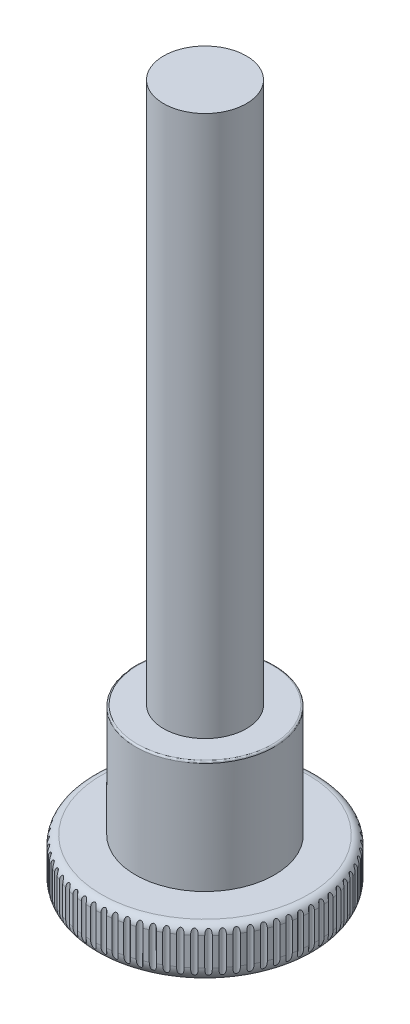
from build123d import *

# Parameters (mm, degrees)
REDONDEO1_R           = 1
REDONDEO3_R           = 0.5
CROQUIS3_R            = 0.178826811
CORTAR_EXTRUIR2_DEPTH = 30.2
MATRIZC1_COUNT        = 70
CORTAR_EXTRUIR3_DEPTH = 4
REDONDEO4_R           = 0.1


with BuildPart() as part:
    # Croquis1 → Revolución1 (revolve)
    with BuildSketch(Plane.XY):
        Polygon((0, 0), (6.75, 0), (6.75, 3.2), (4.2, 3.2), (4.2, 10), (2.5, 10), (2.5, 42.7), (0, 42.7), align=None)
    revolve(axis=Axis((0, 0, 0), (0, 1, 0)))

    # Redondeo1
    redondeo1_edges = [part.edges().sort_by_distance(p)[0] for p in [
        (-6.75, 0, 0),
    ]]
    fillet(redondeo1_edges, radius=REDONDEO1_R)

    # Redondeo3
    redondeo3_edges = [part.edges().sort_by_distance(p)[0] for p in [
        (-6.75, 3.2, 0),
    ]]
    fillet(redondeo3_edges, radius=REDONDEO3_R)

    # Croquis3 → Cortar-Extruir2 (cut)
    with BuildSketch(Plane(origin=(0, 3.2, 0), x_dir=(1, 0, 0), z_dir=(0, 1, 0))):
        with Locations((0, 6.823141063)):
            Circle(CROQUIS3_R)
    cortar_extruir2 = extrude(amount=-CORTAR_EXTRUIR2_DEPTH, mode=Mode.SUBTRACT)

    # MatrizC1: Cortar-Extruir2 ×70 about axis
    matrizc1_axis = Axis((0, 2.7, 0), (0, -1, 0))
    for i in range(1, MATRIZC1_COUNT):
        add(cortar_extruir2.rotate(matrizc1_axis, i * 360 / MATRIZC1_COUNT), mode=Mode.SUBTRACT)

    # Croquis4 → Cortar-Extruir3 (cut)
    with BuildSketch(Plane.XZ):
        Polygon((-2.598076211, 0), (-1.299038106, -2.25), (1.299038106, -2.25), (2.598076211, 0), (1.299038106, 2.25), (-1.299038106, 2.25), align=None)
    extrude(amount=-CORTAR_EXTRUIR3_DEPTH, mode=Mode.SUBTRACT)

    # Croquis5 → Cortar-Revolución2 (revolve, cut)
    with BuildSketch(Plane(origin=(0, 0, 0), x_dir=(0, 0, -1), z_dir=(1, 0, 0))):
        with BuildLine():
            add(Edge.make_bspline(
                [(1.902217052, 0.494287208), (2.051275073, 0.571487381), (2.579426461, 0.249664028), (3.233358424, -0.656577214), (1.623663738, -0.699905553), (1.698844959, 0.388956674), (1.902217052, 0.494287208)],
                knots=[0, 0, 0, 0, 0.197401908, 0.436199854, 0.730668374, 1, 1, 1, 1], degree=3))
        make_face()
    revolve(axis=Axis((0, 0, 0), (0, 1, 0)), mode=Mode.SUBTRACT)

    # Croquis6 → Revolución3 (revolve)
    with BuildSketch(Plane(origin=(0, 0, 0), x_dir=(0, 0, -1), z_dir=(1, 0, 0))):
        with BuildLine():
            add(Edge.make_bspline(
                [(1.724107337, 4), (1.827076222, 3.938313226), (2.087341434, 3.928963181), (2.204186039, 3.531464989), (3.335749315, 2.986917895), (1.053601819, 5.7036858), (1.479384083, 4.146609223), (1.724107337, 4)],
                knots=[0, 0, 0, 0, 0.088250734, 0.185917777, 0.305108901, 0.790256961, 1, 1, 1, 1], degree=3))
        make_face()
    revolve(axis=Axis((0, 4, 0), (0, 1, 0)))

    # Redondeo4
    redondeo4_edges = [part.edges().sort_by_distance(p)[0] for p in [
        (-4.2, 10, 0),
    ]]
    fillet(redondeo4_edges, radius=REDONDEO4_R)


solid = part.part
